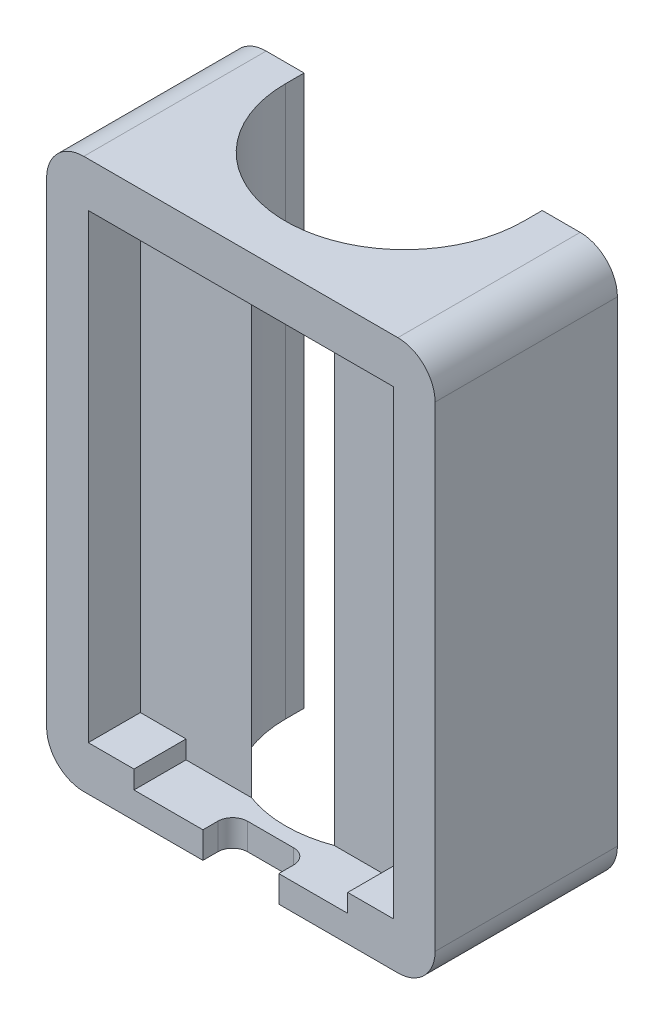
from build123d import *

# Parameters (mm, degrees)
ESQUISSE1_W             = 52.2
ESQUISSE1_H             = 80
BOSS_EXTRU_2_DEPTH      = 22
ESQUISSE3_W             = 48.72
ESQUISSE3_H             = 72.8776
ENL_V_MAT_EXTRU_1_DEPTH = 5
CONG_1_R                = 10
BOSS_EXTRU_4_DEPTH      = 5
ESQUISSE2_R             = 16
ENL_V_MAT_EXTRU_3_DEPTH = 93.647092521
ENL_V_MAT_EXTRU_5_DEPTH = 2
BOSS_EXTRU_6_START      = 6.07
BOSS_EXTRU_6_DEPTH      = 6.07
ESQUISSE12_W            = 52.2
ESQUISSE12_H            = 22
ENL_V_MAT_EXTRU_7_DEPTH = 6.07
ESQUISSE8_W             = 10.19
ESQUISSE8_H             = 3.5612
ENL_V_MAT_EXTRU_6_DEPTH = 4
CONG_3_R                = 2
ESQUISSE9_W             = 10.1
ESQUISSE9_H             = 73.93
BOSS_EXTRU_5_DEPTH      = 2.5
CONG_4_R                = 5


with BuildPart() as part:
    # Esquisse1 → Boss.-Extru.2 (new body)
    with BuildSketch(Plane.XY):
        with Locations((-15.124795362, -42.006460905)):
            Rectangle(ESQUISSE1_W, ESQUISSE1_H)
    extrude(amount=BOSS_EXTRU_2_DEPTH)

    # Esquisse3 → Enlèv. mat.-Extru.1 (cut)
    with BuildSketch(Plane.XY.offset(22)):
        with Locations((-15.124795362, -42.006460905)):
            Rectangle(ESQUISSE3_W, ESQUISSE3_H)
    extrude(amount=-ENL_V_MAT_EXTRU_1_DEPTH, mode=Mode.SUBTRACT)

    # Congé1
    cong_1_edges = [part.edges().sort_by_distance(p)[0] for p in [
        (-39.484795362, -78.445260905, 19.5),
        (9.235204638, -78.445260905, 19.5),
        (9.235204638, -5.567660905, 19.5),
        (-39.484795362, -5.567660905, 19.5),
    ]]
    fillet(cong_1_edges, radius=CONG_1_R)

    # Esquisse5 → Boss.-Extru.4 (add)
    with BuildSketch(Plane.XY.offset(17)):
        with BuildLine():
            Line((-35.624795362, -15.567660905), (-35.624795362, -8.006460905))
            Line((-35.624795362, -8.006460905), (-29.484795362, -8.006460905))
            Line((-29.484795362, -8.006460905), (-0.764795362, -8.006460905))
            Line((-0.764795362, -8.006460905), (5.375204638, -8.006460905))
            Line((5.375204638, -8.006460905), (5.375204638, -15.567660905))
            Line((5.375204638, -15.567660905), (5.375204638, -68.445260905))
            Line((5.375204638, -68.445260905), (5.375204638, -76.006460905))
            Line((5.375204638, -76.006460905), (-0.764795362, -76.006460905))
            Line((-0.764795362, -76.006460905), (-0.764795362, -78.445260905))
            ThreePointArc((-0.764795362, -78.445260905), (6.30627245, -75.516328717), (9.235204638, -68.445260905))
            Line((9.235204638, -68.445260905), (9.235204638, -15.567660905))
            ThreePointArc((9.235204638, -15.567660905), (6.30627245, -8.496593093), (-0.764795362, -5.567660905))
            Line((-0.764795362, -5.567660905), (-29.484795362, -5.567660905))
            ThreePointArc((-29.484795362, -5.567660905), (-36.555863174, -8.496593093), (-39.484795362, -15.567660905))
            Line((-39.484795362, -15.567660905), (-39.484795362, -68.445260905))
            ThreePointArc((-39.484795362, -68.445260905), (-36.555863174, -75.516328717), (-29.484795362, -78.445260905))
            Line((-29.484795362, -78.445260905), (-29.484795362, -76.006460905))
            Line((-29.484795362, -76.006460905), (-35.624795362, -76.006460905))
            Line((-35.624795362, -76.006460905), (-35.624795362, -68.445260905))
            Line((-35.624795362, -68.445260905), (-35.624795362, -15.567660905))
        make_face()
    extrude(amount=BOSS_EXTRU_4_DEPTH)

    # Esquisse2 → Enlèv. mat.-Extru.3 (cut, through all)
    with BuildSketch(Plane.XZ.offset(82.006460905)):
        with Locations((-15.124795362, 0)):
            Circle(ESQUISSE2_R)
    extrude(amount=-ENL_V_MAT_EXTRU_3_DEPTH, mode=Mode.SUBTRACT)

    # Esquisse7 → Enlèv. mat.-Extru.5 (cut)
    with BuildSketch(Plane.XY.offset(17)):
        Polygon((-35.624795362, -8.006460905), (5.375204638, -8.006460905), (5.375204638, -76.006460905), (-0.764795362, -76.006460905), (-0.764795362, -78.445260905), (-29.484795362, -78.445260905), (-29.484795362, -76.006460905), (-35.624795362, -76.006460905), align=None)
    extrude(amount=-ENL_V_MAT_EXTRU_5_DEPTH, mode=Mode.SUBTRACT)

    # Esquisse11 → Boss.-Extru.6 (add)
    with BuildSketch(Plane.XZ.offset(8.006460905).offset(BOSS_EXTRU_6_START)):
        with BuildLine():
            Line((-20.692559725, 15), (-35.624795362, 15))
            Line((-35.624795362, 15), (-35.624795362, 22))
            Line((-35.624795362, 22), (5.375204638, 22))
            Line((5.375204638, 22), (5.375204638, 15))
            Line((5.375204638, 15), (-9.557030999, 15))
            ThreePointArc((-9.557030999, 15), (-15.124795362, 16), (-20.692559725, 15))
        make_face()
    extrude(amount=-BOSS_EXTRU_6_DEPTH)

    # Esquisse12 → Enlèv. mat.-Extru.7 (cut)
    with BuildSketch(Plane(origin=(0, -2.006460905, 0), x_dir=(1, 0, 0), z_dir=(0, 1, 0))):
        with Locations((-15.124795362, -11)):
            Rectangle(ESQUISSE12_W, ESQUISSE12_H)
    extrude(amount=-ENL_V_MAT_EXTRU_7_DEPTH, mode=Mode.SUBTRACT)

    # Esquisse8 → Enlèv. mat.-Extru.6 (cut)
    with BuildSketch(Plane.XY.offset(22)):
        with Locations((-15.124795362, -80.225860905)):
            Rectangle(ESQUISSE8_W, ESQUISSE8_H)
    extrude(amount=-ENL_V_MAT_EXTRU_6_DEPTH, mode=Mode.SUBTRACT)

    # Congé3
    cong_3_edges = [part.edges().sort_by_distance(p)[0] for p in [
        (-10.029795362, -80.225860905, 18),
        (-20.219795362, -80.225860905, 18),
    ]]
    fillet(cong_3_edges, radius=CONG_3_R)

    # Esquisse9 → Boss.-Extru.5 (add)
    with BuildSketch(Plane(origin=(0, 0, 0), x_dir=(-1, 0, 0), z_dir=(0, 0, -1))):
        with Locations((36.174795362, -45.041460905)):
            Rectangle(ESQUISSE9_W, ESQUISSE9_H)
        with Locations((-5.925204638, -45.041460905)):
            Rectangle(ESQUISSE9_W, ESQUISSE9_H)
    extrude(amount=BOSS_EXTRU_5_DEPTH)

    # Congé4
    cong_4_edges = [part.edges().sort_by_distance(p)[0] for p in [
        (10.975204638, -82.006460905, 9.75),
        (-41.224795362, -82.006460905, 9.75),
        (-41.224795362, -8.076460905, 9.75),
        (10.975204638, -8.076460905, 9.75),
    ]]
    fillet(cong_4_edges, radius=CONG_4_R)


solid = part.part
